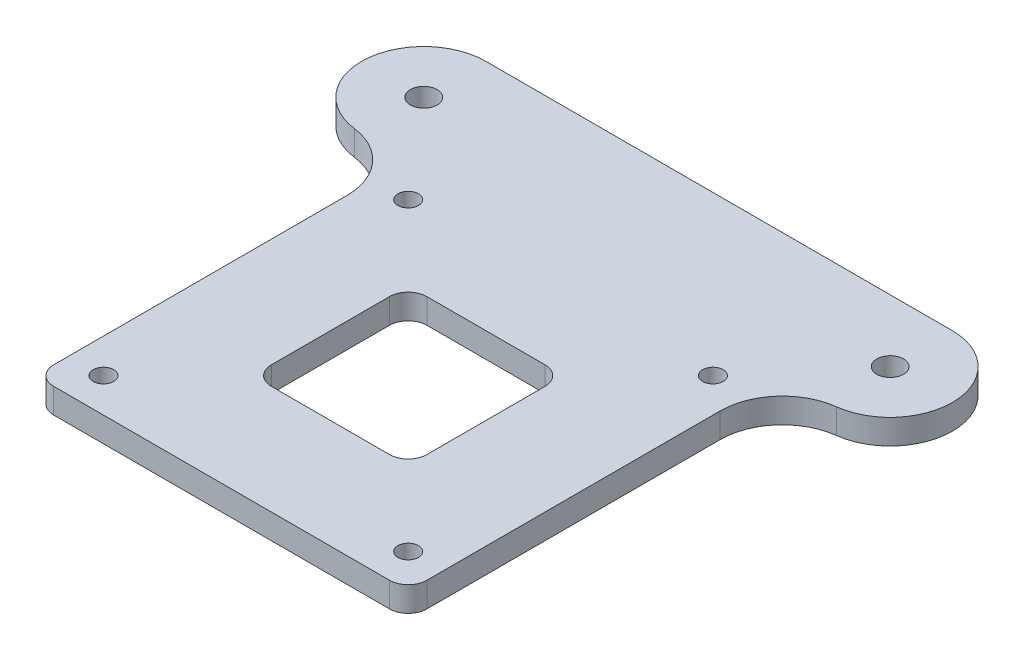
from build123d import *

# Parameters (mm, degrees)
SKETCH1_W               = 60
SKETCH1_H               = 60
SKETCH1_R               = 1.65
BOSS_EXTRUDE1_DEPTH     = 4
SKETCH2_R               = 2.15
BOSS_EXTRUDE2_DEPTH     = 4
FILLET1_R               = 10
FILLET2_R               = 3
CUT_EXTRUDE1_DEPTH      = 70.081473638
CUT_EXTRUDE1_DEPTH_BACK = 70.081473638
SKETCH3_W               = 25
SKETCH3_H               = 25
FILLET3_R               = 3


with BuildPart() as part:
    # Sketch1 → Boss-Extrude1 (new body)
    with BuildSketch(Plane(origin=(0, 0, 0), x_dir=(1, 0, 0), z_dir=(0, 1, 0))):
        Rectangle(SKETCH1_W, SKETCH1_H)
        with Locations(Location((-24.5, 24.5, 0), (0, 0, 270))):
            Circle(SKETCH1_R, mode=Mode.SUBTRACT)
        with Locations(Location((24.5, 24.5, 0), (0, 0, 270))):
            Circle(SKETCH1_R, mode=Mode.SUBTRACT)
        with Locations(Location((-24.5, -24.5, 0), (0, 0, 270))):
            Circle(SKETCH1_R, mode=Mode.SUBTRACT)
        with Locations(Location((24.5, -24.5, 0), (0, 0, 270))):
            Circle(SKETCH1_R, mode=Mode.SUBTRACT)
    extrude(amount=BOSS_EXTRUDE1_DEPTH)

    # Sketch2 → Boss-Extrude2 (add)
    with BuildSketch(Plane(origin=(0, 4, 0), x_dir=(1, 0, 0), z_dir=(0, 1, 0))):
        with BuildLine():
            Line((-37.5, 50), (37.5, 50))
            ThreePointArc((37.5, 50), (47.5, 40), (37.5, 30))
            Line((37.5, 30), (-37.5, 30))
            ThreePointArc((-37.5, 30), (-47.5, 40), (-37.5, 50))
        make_face()
        with Locations(Location((-37.5, 40, 0), (0, 0, 270))):
            Circle(SKETCH2_R, mode=Mode.SUBTRACT)
        with Locations(Location((37.5, 40, 0), (0, 0, 270))):
            Circle(SKETCH2_R, mode=Mode.SUBTRACT)
    extrude(amount=-BOSS_EXTRUDE2_DEPTH)

    # Fillet1
    # the kernel refuses this fillet: 10 mm, written as the material it adds along each edge
    with BuildSketch(Plane(origin=(-30, 0, -30), x_dir=(-0.9999598282483387, 0, -0.008963363740972157), z_dir=(0, 1, 0))) as fillet1_piece_1:
        with BuildLine():
            CenterArc((9.911370685, 9.932373054), FILLET1_R, 180.51356979, 82.819244219)
            Line((-0.088227598, 9.842739417), (-1.088187426, 9.833776053))
            Line((-1.088187426, 9.833776053), (-0.999959828, -0.008963364))
            Line((-0.999959828, -0.008963364), (0.008963364, -0.999959828))
            ThreePointArc((0.008963364, -0.999959828), (7.508662076, -0.9327346), (8.6342496, -0.993237305))
            Line((8.6342496, -0.993237305), (8.750351517, 0))
        make_face()
    extrude(amount=4)
    with BuildSketch(Plane(origin=(30, 0, -30), x_dir=(0.9999598282483387, 0, -0.008963363740972154), z_dir=(0, 1, 0))) as fillet1_piece_2:
        with BuildLine():
            CenterArc((9.911370685, -9.932373054), FILLET1_R, 96.667185992, 82.819244219)
            Line((-0.088227598, -9.842739417), (-1.088187426, -9.833776053))
            Line((-1.088187426, -9.833776053), (-0.999959828, 0.008963364))
            Line((-0.999959828, 0.008963364), (0.008963364, 0.999959828))
            ThreePointArc((0.008963364, 0.999959828), (7.508662076, 0.9327346), (8.6342496, 0.993237305))
            Line((8.6342496, 0.993237305), (8.750351517, 0))
        make_face()
    extrude(amount=4)
    # the kernel refuses this fillet: 10 mm, written as the material it takes off along each edge

    # Fillet2
    fillet2_edges = [part.edges().sort_by_distance(p)[0] for p in [
        (30, 2, 30),
        (-30, 2, 30),
    ]]
    fillet(fillet2_edges, radius=FILLET2_R)

    # Sketch3 → Cut-Extrude1 (cut, two sides: drawn at the far end of the back side and taken through both)
    with BuildSketch(Plane(origin=(0, 4, 0), x_dir=(1, 0, 0), z_dir=(0, 1, 0)).offset(-CUT_EXTRUDE1_DEPTH_BACK)):
        Rectangle(SKETCH3_W, SKETCH3_H)
    extrude(amount=CUT_EXTRUDE1_DEPTH + CUT_EXTRUDE1_DEPTH_BACK, mode=Mode.SUBTRACT)

    # Fillet3
    fillet3_edges = [part.edges().sort_by_distance(p)[0] for p in [
        (12.5, 2, -12.5),
        (12.5, 2, 12.5),
        (-12.5, 2, 12.5),
        (-12.5, 2, -12.5),
    ]]
    fillet(fillet3_edges, radius=FILLET3_R)


solid = part.part
